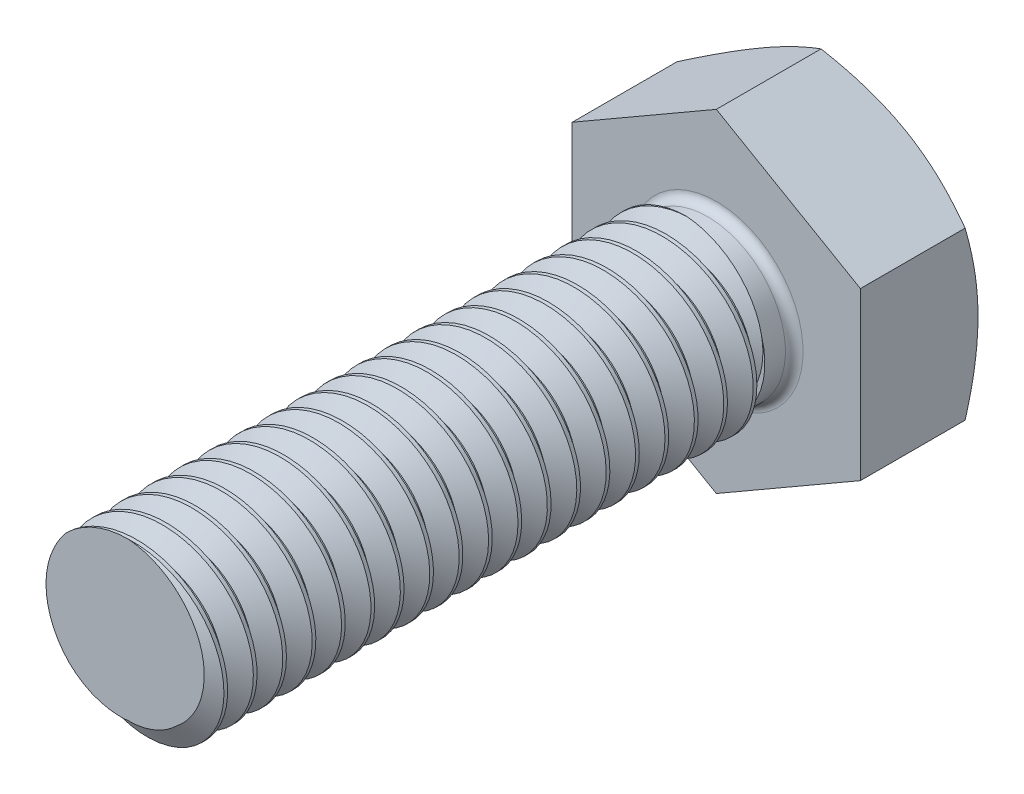
from build123d import *
from build123d.topology import SkipClean

# Parameters (mm, degrees)
SKETCH1_R           = 3
BOSS_EXTRUDE1_DEPTH = 50
CUT_SWEEP1_PITCH    = 1
BOSS_EXTRUDE2_DEPTH = 4
SKETCH6_OUTSIDE_W   = 26.472
SKETCH6_OUTSIDE_H   = 27.988
SKETCH6_OUTSIDE_R   = 4.9
CUT_EXTRUDE1_DEPTH  = 1
CUT_EXTRUDE1_DRAFT  = -60
SKETCH7_W           = 1
SKETCH7_H           = 3
SKETCH8_W           = 1
SKETCH8_H           = 0.35
FILLET1_R           = 0.3
SKETCH9_R           = 3
CUT_EXTRUDE2_DEPTH  = 30


with BuildPart() as part:
    # Sketch1 → Boss-Extrude1 (new body)
    with BuildSketch(Plane.XY):
        Circle(SKETCH1_R)
    extrude(amount=-BOSS_EXTRUDE1_DEPTH)

    # Cut-Sweep1: arcs per turn and ends read off the stored shape
    # Cut-Sweep1: the profile of Sketch3 profile screwed along a right-hand helix through 53 turns, 6 arcs to a turn; built about Z, then put on its axis
    cut_sweep1_z = Axis((0, 0, 0), (0, 0, 1))
    cut_sweep1_corners = [(3.0003, 0, -1.875173205), (3.0003, 0, -0.999826795), (2.350480947, 0, -1.375), (2.350480947, 0, -1.5)]
    with BuildLine(mode=Mode.PRIVATE) as cut_sweep1_profile:
        Line(cut_sweep1_corners[0], cut_sweep1_corners[1])
        Line(cut_sweep1_corners[1], cut_sweep1_corners[2])
        Line(cut_sweep1_corners[2], cut_sweep1_corners[3])
        Line(cut_sweep1_corners[3], cut_sweep1_corners[0])
    cut_sweep1_cap = Face(cut_sweep1_profile.wire())
    cut_sweep1_turn_angles = [0, 30, 60, 90, 120, 150, 180, 210, 240, 270, 300, 330, 360]
    cut_sweep1_turn_weights = [1, 0.8660254037844387, 1, 0.8660254037844387, 1, 0.8660254037844387, 1, 0.8660254037844387, 1, 0.8660254037844387, 1, 0.8660254037844387, 1]
    cut_sweep1_turn_rails = [Edge.make_bspline([Vector(p[0], p[1], 0).rotate(cut_sweep1_z, cut_sweep1_turn_angles[k]) / cut_sweep1_turn_weights[k] + Vector(0, 0, p[2] + CUT_SWEEP1_PITCH * cut_sweep1_turn_angles[k] / 360) for k in range(13)], [0, 0, 0, 1, 1, 2, 2, 3, 3, 4, 4, 5, 5, 6, 6, 6], 2, cut_sweep1_turn_weights) for p in cut_sweep1_corners]
    cut_sweep1_turn_sides = [Face.make_surface_from_curves(cut_sweep1_turn_rails[p[0]], cut_sweep1_turn_rails[p[1]]) for p in [(0, 1), (1, 2), (2, 3), (3, 0)]]
    cut_sweep1 = Plane(origin=(0, 0, 0), x_dir=(0, 1, 0), z_dir=(0, 0, -1)) * Solid(Shell([*[p.moved(Location((0, 0, CUT_SWEEP1_PITCH * i))) for i in range(53) for p in cut_sweep1_turn_sides], cut_sweep1_cap, cut_sweep1_cap.rotate(cut_sweep1_z, 19080).moved(Location((0, 0, CUT_SWEEP1_PITCH * 19080 / 360)))]))
    add(cut_sweep1, mode=Mode.SUBTRACT)

    # Sketch4 → Cut-Revolve1 (revolve, cut)
    with BuildSketch(Plane(origin=(0, 0, 0), x_dir=(0, 0, -1), z_dir=(1, 0, 0)), mode=Mode.PRIVATE) as cut_revolve1_sk:
        Polygon((0, 3), (0.630186784, 3), (0, 2.1), align=None)
    revolve(cut_revolve1_sk.sketch.rotate(Axis((0, 0, -50), (0, 0, 1)), 90), axis=Axis((0, 0, -50), (0, 0, 1)), mode=Mode.SUBTRACT)

    # Sketch5 → Boss-Extrude2 (add)
    with BuildSketch(Plane(origin=(0, 0, -50), x_dir=(-1, 0, 0), z_dir=(0, 0, -1))):
        Polygon((4.9, -2.829016319), (4.9, 2.829016319), (0, 5.658032638), (-4.9, 2.829016319), (-4.9, -2.829016319), (0, -5.658032638), align=None)
    extrude(amount=BOSS_EXTRUDE2_DEPTH)


with BuildPart() as cut_extrude1_tool:
    # Sketch6 outside → Cut-Extrude1 (with draft: the straight prism first)
    with BuildSketch(Plane(origin=(0, 0, -54), x_dir=(-1, 0, 0), z_dir=(0, 0, -1))):
        Rectangle(SKETCH6_OUTSIDE_W, SKETCH6_OUTSIDE_H)
        Circle(SKETCH6_OUTSIDE_R, mode=Mode.SUBTRACT)
    extrude(amount=-CUT_EXTRUDE1_DEPTH)
    # Cut-Extrude1: the draft: its side faces are tilted about the plane it starts from
    cut_extrude1_sides = [cut_extrude1_tool.faces().sort_by_distance(p)[0] for p in [
        (0, -13.994, -53.5),
        (-13.236, 0, -53.5),
        (0, 13.994, -53.5),
        (13.236, 0, -53.5),
        (4.9, 0, -53.5),
    ]]
    draft(cut_extrude1_sides, Plane(origin=(0, 0, -54), x_dir=(-1, 0, 0), z_dir=(0, 0, -1)), CUT_EXTRUDE1_DRAFT)


with BuildPart() as part_1:
    add(part.part)

    # Cut-Extrude1: cut by cut_extrude1_tool
    add(cut_extrude1_tool.part, mode=Mode.SUBTRACT)

    # Sketch7 → Revolve1 (revolve)
    with SkipClean():  # the faces are left unmerged after this step: merging them gives an invalid solid
        with BuildSketch(Plane(origin=(0, 0, 0), x_dir=(0, 0, -1), z_dir=(1, 0, 0)), mode=Mode.PRIVATE) as revolve1_sk:
            with Locations((49.5, 1.5)):
                Rectangle(SKETCH7_W, SKETCH7_H)
        revolve(revolve1_sk.sketch.rotate(Axis((0, 0, -50), (0, 0, 1)), 90), axis=Axis((0, 0, -50), (0, 0, 1)))

    # Sketch8 → Cut-Revolve2 (revolve, cut)
    with BuildSketch(Plane(origin=(0, 0, 0), x_dir=(0, 0, -1), z_dir=(1, 0, 0)), mode=Mode.PRIVATE) as cut_revolve2_sk:
        with Locations((49.5, 2.825)):
            Rectangle(SKETCH8_W, SKETCH8_H)
    revolve(cut_revolve2_sk.sketch.rotate(Axis((0, 0, -50), (0, 0, 1)), 90), axis=Axis((0, 0, -50), (0, 0, 1)), mode=Mode.SUBTRACT)

    # Fillet1
    fillet1_edges = [part_1.edges().sort_by_distance(p)[0] for p in [
        (2.65, 0, -50),
    ]]
    fillet(fillet1_edges, radius=FILLET1_R)

    # Sketch9 → Cut-Extrude2 (cut)
    with BuildSketch(Plane.XY):
        Circle(SKETCH9_R)
    extrude(amount=-CUT_EXTRUDE2_DEPTH, mode=Mode.SUBTRACT)


solid = part_1.part
